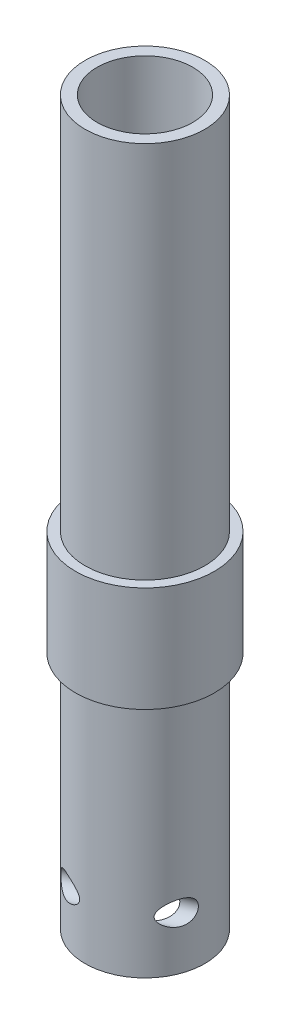
from build123d import *

# Parameters (mm, degrees)
SKETCH1_R                = 12.5
SKETCH1_R_2              = 10
BOSS_EXTRUDE1_DEPTH      = 100
BOSS_EXTRUDE2_DEPTH      = 85
BOSS_EXTRUDE2_DEPTH_BACK = 4
SKETCH6_R                = 12.5
SKETCH6_R_2              = 10
BOSS_EXTRUDE3_START      = -84
SKETCH7_R                = 14.5
SKETCH7_R_2              = 10
BOSS_EXTRUDE3_DEPTH      = 1
CUT_EXTRUDE1_DEPTH       = 187.133016953
CUT_EXTRUDE1_DEPTH_BACK  = 187.133016953
SKETCH11_W               = 35.010034018
SKETCH11_H               = 2.4
CUT_EXTRUDE3_DEPTH       = 187.133016953
CUT_EXTRUDE3_DEPTH_BACK  = 187.133016953
SKETCH13_W               = 31.609051685
SKETCH13_H               = 42.8
SKETCH14_R               = 14.5
BOSS_EXTRUDE4_DEPTH      = 21
SKETCH15_R               = 10
CUT_EXTRUDE4_DEPTH       = 22
BOSS_EXTRUDE5_START      = 10
SKETCH17_R               = 12.5
SKETCH17_R_2             = 10
BOSS_EXTRUDE5_DEPTH      = 10
SKETCH18_R               = 2.5
CUT_EXTRUDE5_DEPTH       = 54


with BuildPart() as part:
    # Sketch1 → Boss-Extrude1 (new body)
    with BuildSketch(Plane(origin=(0, 0, 0), x_dir=(1, 0, 0), z_dir=(0, 1, 0))):
        Circle(SKETCH1_R)
        Circle(SKETCH1_R_2, mode=Mode.SUBTRACT)
    extrude(amount=BOSS_EXTRUDE1_DEPTH)

    # Sketch6 → Boss-Extrude2 (add, two sides: drawn at the far end of the back side and taken through both)
    with BuildSketch(Plane(origin=(0, 100, 0), x_dir=(1, 0, 0), z_dir=(0, 1, 0)).offset(-BOSS_EXTRUDE2_DEPTH_BACK)):
        Circle(SKETCH6_R)
        Circle(SKETCH6_R_2, mode=Mode.SUBTRACT)
    extrude(amount=BOSS_EXTRUDE2_DEPTH + BOSS_EXTRUDE2_DEPTH_BACK)

    # Sketch7 → Boss-Extrude3 (add)
    with BuildSketch(Plane.XZ.offset(BOSS_EXTRUDE3_START)):
        Circle(SKETCH7_R)
        Circle(SKETCH7_R_2, mode=Mode.SUBTRACT)
    extrude(amount=-BOSS_EXTRUDE3_DEPTH)

    # Sketch11 → Cut-Extrude1 (cut, two sides: drawn at the far end of the back side and taken through both)
    with BuildSketch(Plane(origin=(0, 0, 0), x_dir=(0, 0, -1), z_dir=(1, 0, 0)).offset(-CUT_EXTRUDE1_DEPTH_BACK)):
        Rectangle(SKETCH11_W, SKETCH11_H)
    extrude(amount=CUT_EXTRUDE1_DEPTH + CUT_EXTRUDE1_DEPTH_BACK, mode=Mode.SUBTRACT)

    # Sketch13 → Cut-Extrude3 (cut, two sides: drawn at the far end of the back side and taken through both)
    with BuildSketch(Plane.XY.offset(-CUT_EXTRUDE3_DEPTH_BACK)):
        with Locations((3.304525843, 22.6)):
            Rectangle(SKETCH13_W, SKETCH13_H)
    extrude(amount=CUT_EXTRUDE3_DEPTH + CUT_EXTRUDE3_DEPTH_BACK, mode=Mode.SUBTRACT)

    # Sketch14 → Boss-Extrude4 (add)
    with BuildSketch(Plane(origin=(0, 85, 0), x_dir=(1, 0, 0), z_dir=(0, 1, 0))):
        Circle(SKETCH14_R)
    extrude(amount=BOSS_EXTRUDE4_DEPTH)

    # Sketch15 → Cut-Extrude4 (cut)
    with BuildSketch(Plane.XZ.offset(-85)):
        Circle(SKETCH15_R)
    extrude(amount=-CUT_EXTRUDE4_DEPTH, mode=Mode.SUBTRACT)

    # Sketch17 → Boss-Extrude5 (add)
    with BuildSketch(Plane.XZ.offset(-44).offset(BOSS_EXTRUDE5_START)):
        Circle(SKETCH17_R)
        Circle(SKETCH17_R_2, mode=Mode.SUBTRACT)
    extrude(amount=-BOSS_EXTRUDE5_DEPTH)

    # Sketch18 → Cut-Extrude5 (cut)
    with BuildSketch(Plane(origin=(35.019010809, 0, -14.753605728), x_dir=(-0.38825278231327914, 1.212401304802914e-15, -0.9215529160205601), z_dir=(0.9215529160205602, -2.877743595734803e-15, -0.3882527823132792))):
        with Locations((-8.5, 45)):
            Circle(SKETCH18_R)
    extrude(amount=-CUT_EXTRUDE5_DEPTH, mode=Mode.SUBTRACT)


solid = part.part
